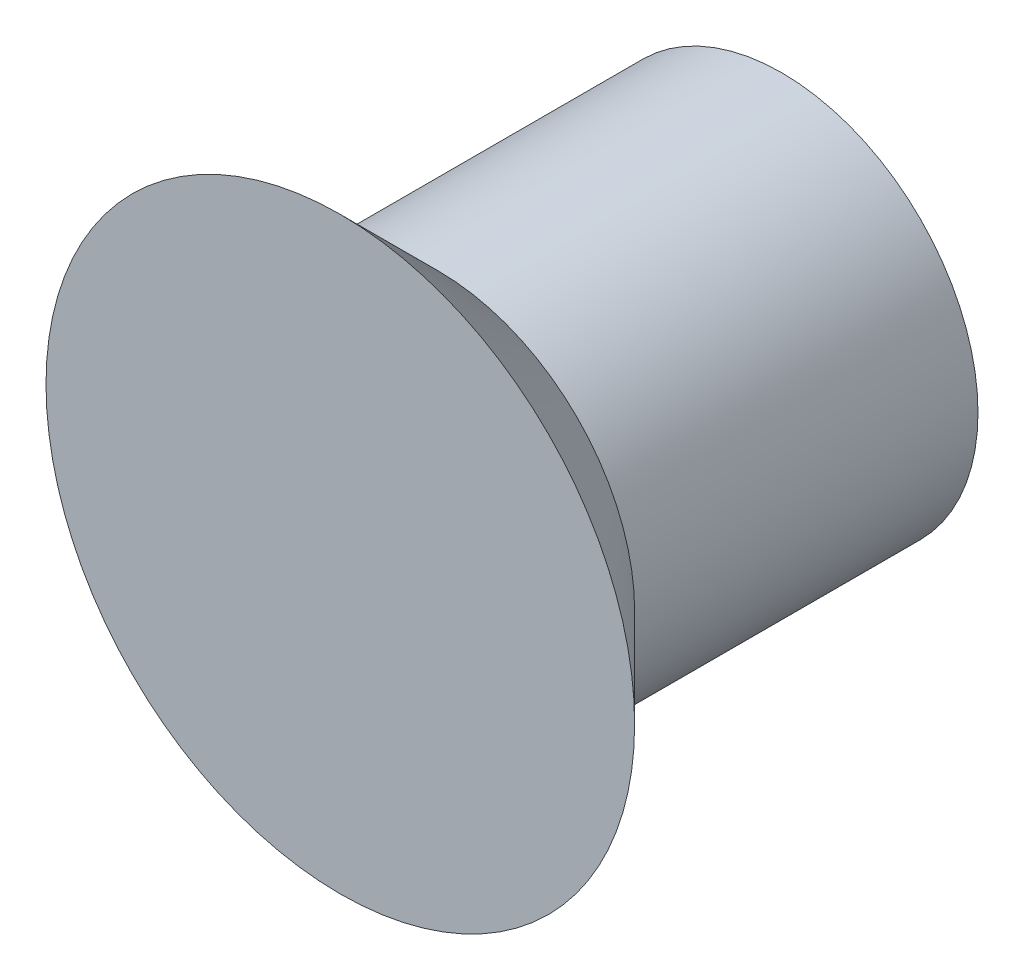
from build123d import *

# Parameters (mm, degrees)
IZIM1_R                     = 2
Y_KSEKLIK_EKSTR_ZYON1_DEPTH = 3.5
IZIM3_R                     = 2
Y_KSEKLIK_EKSTR_ZYON3_DEPTH = 1
Y_KSEKLIK_EKSTR_ZYON3_DRAFT = -45


with BuildPart() as part:
    # Çizim1 → Yükseklik-Ekstrüzyon1 (new body)
    with BuildSketch(Plane.XY):
        Circle(IZIM1_R)
    extrude(amount=Y_KSEKLIK_EKSTR_ZYON1_DEPTH)


with BuildPart() as y_kseklik_ekstr_zyon3_tool:
    # Çizim3 → Yükseklik-Ekstrüzyon3 (with draft: the straight prism first)
    with BuildSketch(Plane.XY.offset(3.5)):
        Circle(IZIM3_R)
    extrude(amount=Y_KSEKLIK_EKSTR_ZYON3_DEPTH)
    # Yükseklik-Ekstrüzyon3: the draft: its side faces are tilted about the plane it starts from
    y_kseklik_ekstr_zyon3_sides = [y_kseklik_ekstr_zyon3_tool.faces().sort_by_distance(p)[0] for p in [
        (-2, 0, 4),
    ]]
    draft(y_kseklik_ekstr_zyon3_sides, Plane.XY.offset(3.5), Y_KSEKLIK_EKSTR_ZYON3_DRAFT)


with BuildPart() as part_1:
    add(part.part)

    # Yükseklik-Ekstrüzyon3: add y_kseklik_ekstr_zyon3_tool
    add(y_kseklik_ekstr_zyon3_tool.part)


solid = part_1.part
